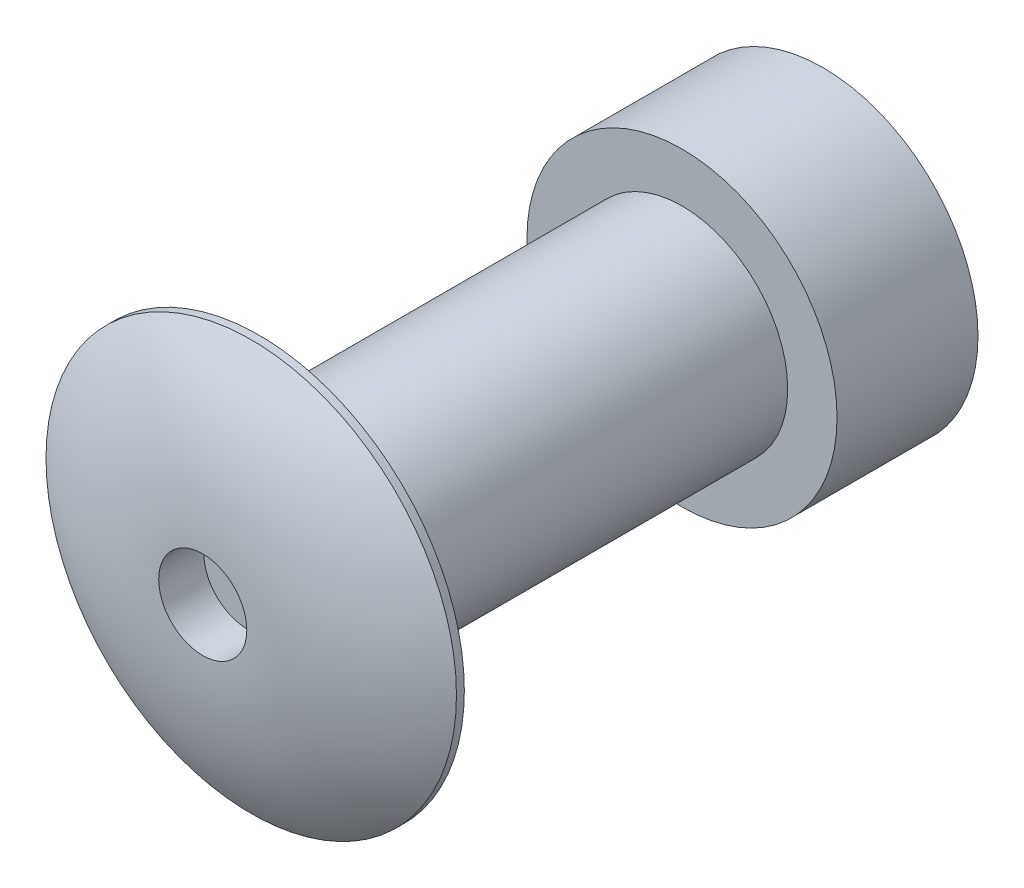
from build123d import *

# Parameters (mm, degrees)
SKETCH4_R          = 0.9921875
CUT_EXTRUDE1_DEPTH = 1.016
CUT_EXTRUDE2_START = -2.54
SKETCH3_R          = 0.9921875
CUT_EXTRUDE2_DEPTH = 2.54


with BuildPart() as part:
    # Sketch2 → Revolve1 (revolve)
    with BuildSketch(Plane(origin=(0, 0, 0), x_dir=(0, 0, -1), z_dir=(1, 0, 0))):
        with BuildLine():
            Line((-1.27, 0.9921875), (-1.27, 0))
            Line((-1.27, 0), (9.525, 0))
            Line((9.525, 0), (12.7, 0))
            Line((12.7, 0), (12.7, 3.4925))
            Line((12.7, 3.4925), (9.525, 3.4925))
            Line((9.525, 3.4925), (9.525, 2.38125))
            Line((9.525, 2.38125), (0, 2.38125))
            Line((0, 2.38125), (0, 4.6228))
            Line((0, 4.6228), (-0.1778, 4.6228))
            ThreePointArc((-0.1778, 4.6228), (-0.991036966, 2.887856773), (-1.27, 0.9921875))
        make_face()
    revolve(axis=Axis((0, 0, 7.600580616), (0, 0, 1)))

    # Sketch4 → Cut-Extrude1 (cut)
    with BuildSketch(Plane.XY.offset(1.27)):
        Circle(SKETCH4_R)
    extrude(amount=-CUT_EXTRUDE1_DEPTH, mode=Mode.SUBTRACT)

    # Sketch3 → Cut-Extrude2 (cut)
    with BuildSketch(Plane(origin=(0, 0, -12.7), x_dir=(-1, 0, 0), z_dir=(0, 0, -1)).offset(CUT_EXTRUDE2_START)):
        Circle(SKETCH3_R)
    extrude(amount=CUT_EXTRUDE2_DEPTH, mode=Mode.SUBTRACT)


solid = part.part
